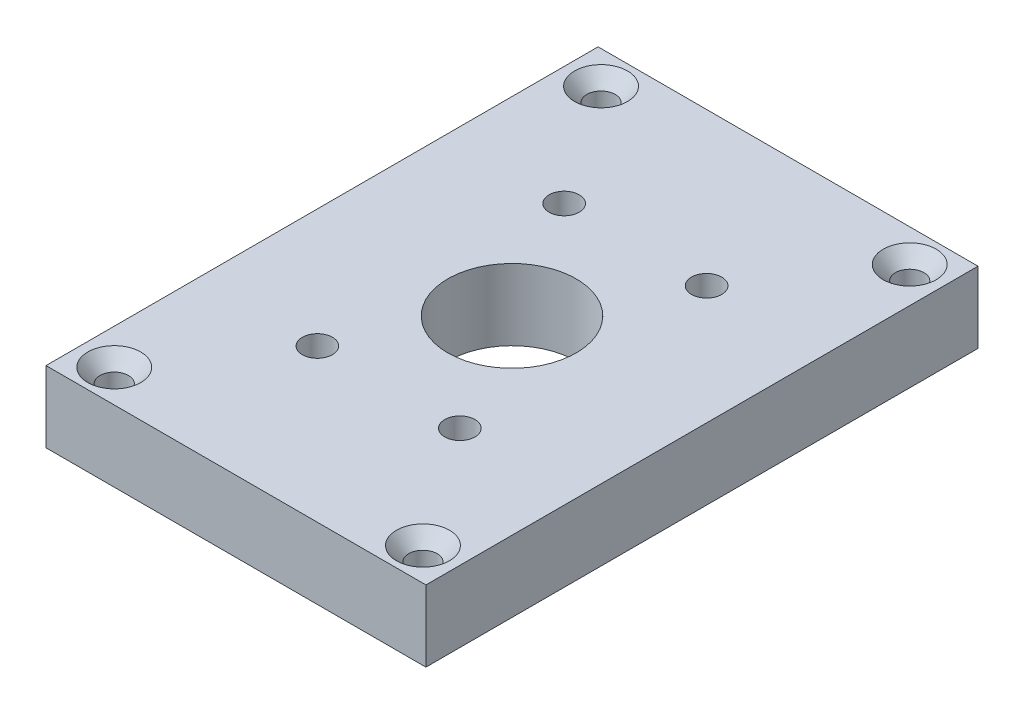
from build123d import *

# Parameters (mm, degrees)
SKETCH1_W                                      = 50.8
SKETCH1_H                                      = 73.81875
BOSS_EXTRUDE1_DEPTH                            = 9.525
CSK_FOR_6_FLAT_HEAD_MACHINE_SCREW1_D           = 3.7973
CSK_FOR_6_FLAT_HEAD_MACHINE_SCREW1_CSINK_D     = 7.0866
CSK_FOR_6_FLAT_HEAD_MACHINE_SCREW1_CSINK_ANGLE = 82
CUT_EXTRUDE1_DASH_036_DEPTH                    = 1.3208
SKETCH5_R                                      = 8.5852
CUT_EXTRUDE1_DEPTH                             = 46.805977644
CIRPATTERN1_COUNT                              = 6


with BuildPart() as part:
    # Sketch1 → Boss-Extrude1 (new body)
    with BuildSketch(Plane(origin=(0, 0, 0), x_dir=(1, 0, 0), z_dir=(0, 1, 0))):
        Rectangle(SKETCH1_W, SKETCH1_H)
    extrude(amount=BOSS_EXTRUDE1_DEPTH)

    # CSK for #6 Flat Head Machine Screw1 (through all)
    with Locations(Plane(origin=(0, 9.525, 0), x_dir=(-1, 0, 0), z_dir=(0, 1, 0))):
        with Locations((20.6375, -32.54375), (-20.6375, -32.54375), (-20.6375, 32.54375), (20.6375, 32.54375)):
            CounterSinkHole(CSK_FOR_6_FLAT_HEAD_MACHINE_SCREW1_D / 2, CSK_FOR_6_FLAT_HEAD_MACHINE_SCREW1_CSINK_D / 2, counter_sink_angle=CSK_FOR_6_FLAT_HEAD_MACHINE_SCREW1_CSINK_ANGLE)

    # Sketch4 → Cut-Extrude1 - dash 036 (cut)
    with BuildSketch(Plane(origin=(0, 0, 0), x_dir=(-1, 0, 0), z_dir=(0, -1, 0))):
        with BuildLine():
            Line((-11.1125, 34.6075), (11.1125, 34.6075))
            ThreePointArc((11.1125, 34.6075), (17.147232113, 32.107832113), (19.6469, 26.0731))
            Line((19.6469, 26.0731), (19.6469, -26.0731))
            ThreePointArc((19.6469, -26.0731), (17.147232113, -32.107832113), (11.1125, -34.6075))
            Line((11.1125, -34.6075), (-11.1125, -34.6075))
            ThreePointArc((-11.1125, -34.6075), (-17.147232113, -32.107832113), (-19.6469, -26.0731))
            Line((-19.6469, -26.0731), (-19.6469, 26.0731))
            ThreePointArc((-19.6469, 26.0731), (-17.147232113, 32.107832113), (-11.1125, 34.6075))
        make_face()
        with BuildLine():
            Line((-11.1125, -32.4231), (11.1125, -32.4231))
            ThreePointArc((11.1125, -32.4231), (15.602628061, -30.563228061), (17.4625, -26.0731))
            Line((17.4625, -26.0731), (17.4625, 26.0731))
            ThreePointArc((17.4625, 26.0731), (15.602628061, 30.563228061), (11.1125, 32.4231))
            Line((11.1125, 32.4231), (-11.1125, 32.4231))
            ThreePointArc((-11.1125, 32.4231), (-15.602628061, 30.563228061), (-17.4625, 26.0731))
            Line((-17.4625, 26.0731), (-17.4625, -26.0731))
            ThreePointArc((-17.4625, -26.0731), (-15.602628061, -30.563228061), (-11.1125, -32.4231))
        make_face(mode=Mode.SUBTRACT)
    extrude(amount=-CUT_EXTRUDE1_DASH_036_DEPTH, mode=Mode.SUBTRACT)

    # Sketch5 → Cut-Extrude1 (cut, through all)
    with BuildSketch(Plane(origin=(0, 9.525, 0), x_dir=(1, 0, 0), z_dir=(0, 1, 0))):
        Circle(SKETCH5_R)
    extrude(amount=-CUT_EXTRUDE1_DEPTH, mode=Mode.SUBTRACT)

    # Sketch9 → #10-32 Tapped Hole2 (revolve, cut)
    with BuildSketch(Plane(origin=(9.525, 9.525, -16.497783942), x_dir=(0, 0, 1), z_dir=(1, 0, 0))):
        Polygon((0, 0), (0, 7.563317848), (2.0193, 6.35), (2.0193, 0), align=None)
    f_10_32_tapped_hole2 = revolve(axis=Axis((9.525, 15.875, -16.497783942), (0, -1, 0)), mode=Mode.SUBTRACT)

    # CirPattern1: #10-32 Tapped Hole2 ×6 about axis, 2 skipped
    cirpattern1_axis = Axis((0, 9.525, 0), (0, 1, 0))
    add([f_10_32_tapped_hole2.rotate(cirpattern1_axis, i * 360 / CIRPATTERN1_COUNT) for i in range(1, CIRPATTERN1_COUNT) if i not in (2, 5)], mode=Mode.SUBTRACT)


solid = part.part
